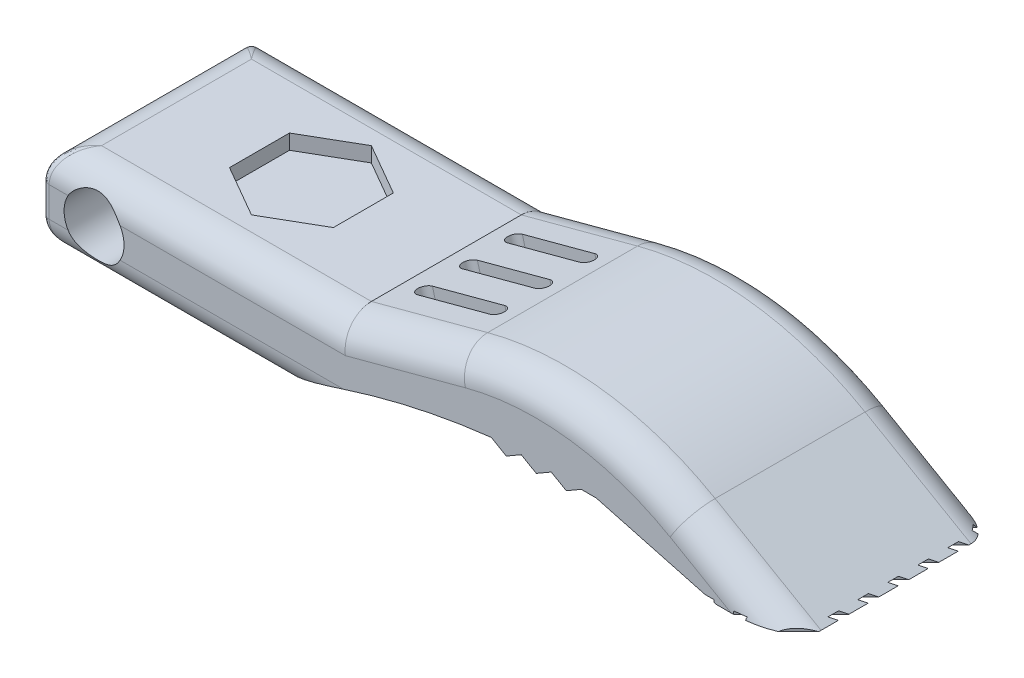
from build123d import *

# Parameters (mm, degrees)
BOSS_EXTRUDE1_DEPTH = 7
FILLET1_R           = 2
FILLET1_R_2         = 0.5
SKETCH2_R           = 2
CUT_EXTRUDE1_DEPTH  = 3
CUT_EXTRUDE2_DEPTH  = 1
CUT_EXTRUDE3_DEPTH  = 1
LPATTERN1_COUNT     = 2
LPATTERN1_PITCH     = 3
LPATTERN1_COL_COUNT = 2
LPATTERN1_COL_PITCH = 3
CUT_EXTRUDE4_DEPTH  = 0.2
LPATTERN3_START     = 2
LPATTERN3_DEPTH     = 0.2


# Read off the part's stored shape, not the designer's step: LPattern3
with BuildPart() as part:
    # Sketch1 → Boss-Extrude1 (new, symmetric)
    with BuildSketch(Plane.XY):
        with BuildLine():
            Line((0, 0), (0, 6))
            Line((0, 6), (20, 6))
            Line((20, 6), (27.756338699, 8.078304691))
            ThreePointArc((27.756338699, 8.078304691), (35.543243446, 8.588685392), (42.932719601, 6.080296241))
            Line((42.932719601, 6.080296241), (50, 2))
            Line((50, 2), (45, 2))
            Line((45, 2), (37, 4.143593539))
            Line((37, 4.143593539), (36, 4.143593539))
            Line((36, 4.143593539), (35, 3.56624327))
            Line((35, 3.56624327), (34, 4.143593539))
            Line((34, 4.143593539), (33, 3.56624327))
            Line((33, 3.56624327), (32, 4.143593539))
            Line((32, 4.143593539), (31, 3.56624327))
            Line((31, 3.56624327), (30, 4.143593539))
            ThreePointArc((30, 4.143593539), (22.337807681, 2.658940457), (15, 0))
            Line((15, 0), (0, 0))
        make_face()
    extrude(amount=BOSS_EXTRUDE1_DEPTH, both=True)

    # Fillet1
    fillet1_edges = [part.edges().sort_by_distance(p)[0] for p in [
        (10, 6, 7),
        (10, 6, -7),
        (23.87816935, 7.039152345, -7),
        (23.87816935, 7.039152345, 7),
        (7.5, 0, -7),
        (7.5, 0, 7),
        (0, 6, 0),
        (0, 0, 0),
        (35.543243446, 8.588685392, 7),
        (46.466359801, 4.04014812, 7),
        (35.543243446, 8.588685392, -7),
        (46.466359801, 4.04014812, -7),
    ]]
    fillet(fillet1_edges, radius=FILLET1_R)
    fillet1_2_edges = [part.edges().sort_by_distance(p)[0] for p in [
        (0, 3, 7),
        (0, 3, -7),
        (0.585786438, 0.585786438, -6.414213562),
        (0.585786438, 5.414213562, -6.414213562),
        (0.585786438, 0.585786438, 6.414213562),
        (0.585786438, 5.414213562, 6.414213562),
    ]]
    fillet(fillet1_2_edges, radius=FILLET1_R_2)

    # Sketch2 → Cut-Extrude1 (cut)
    with BuildSketch(Plane.XY.offset(7)):
        with Locations((3.5, 3)):
            Circle(SKETCH2_R)
    cut_extrude1 = extrude(amount=-CUT_EXTRUDE1_DEPTH, mode=Mode.SUBTRACT)

    # Mirror1: Cut-Extrude1 across plane
    add(cut_extrude1.mirror(Plane.XY), mode=Mode.SUBTRACT)

    # Sketch3 → Cut-Extrude2 (cut)
    with BuildSketch(Plane(origin=(0, 6, 0), x_dir=(1, 0, 0), z_dir=(0, 1, 0))):
        Polygon((14.464101615, -2), (14.464101615, 2), (11, 4), (7.535898385, 2), (7.535898385, -2), (11, -4), align=None)
    extrude(amount=-CUT_EXTRUDE2_DEPTH, mode=Mode.SUBTRACT)

    # Sketch4 → Cut-Extrude3 (cut)
    with BuildSketch(Plane(origin=(-0.160254038, 0.598076211, 0), x_dir=(0.9659258262890675, 0.2588190451025235, 0), z_dir=(-0.2588190451025235, 0.9659258262890675, 0))):
        with BuildLine():
            Line((22.5, 0.5), (27.5, 0.5))
            ThreePointArc((27.5, 0.5), (28, 0), (27.5, -0.5))
            Line((27.5, -0.5), (22.5, -0.5))
            ThreePointArc((22.5, -0.5), (22, 0), (22.5, 0.5))
        make_face()
    cut_extrude3 = extrude(amount=-CUT_EXTRUDE3_DEPTH, mode=Mode.SUBTRACT)

    # LPattern1: Cut-Extrude3 ×2
    with Locations(*[(0, 0, -i * LPATTERN1_PITCH) for i in range(1, LPATTERN1_COUNT)]):
        add(cut_extrude3, mode=Mode.SUBTRACT)

    # LPattern1 col: Cut-Extrude3 ×2
    with Locations(*[(0, 0, i * LPATTERN1_COL_PITCH) for i in range(1, LPATTERN1_COL_COUNT)]):
        add(cut_extrude3, mode=Mode.SUBTRACT)

    # Sketch5 → Cut-Extrude4 (cut)
    with BuildSketch(Plane.XZ.offset(-2)):
        Polygon((52.626524164, -5.480077554), (42.019922446, 5.126524164), (42.373475836, 5.480077554), (52.980077554, -5.126524164), align=None)
    extrude(amount=-CUT_EXTRUDE4_DEPTH, mode=Mode.SUBTRACT)

    # LPattern3 outline → LPattern3 (cut)
    with BuildSketch(Plane(origin=(0, 0, 0), x_dir=(1, 0, 0), z_dir=(0, 1, 0)).offset(LPATTERN3_START)):
        Polygon((52, -3.146446612), (49.987319121, -5.159127489), (48.646995454, -6.499451155), (48.146446609, -7), (52, -7), align=None)
        Polygon((50, -3.853553391), (52, -1.853553392), (52, -1.146446609), (46.146446609, -7), (46.85355339, -7), (46.905469383, -6.948084007), align=None)
        Polygon((44.853553391, -7), (52, 0.146446609), (52, 0.853553391), (44.146446609, -7), align=None)
        Polygon((50, 0.146446609), (52, 2.146446609), (52, 2.853553391), (43, -6.146446609), (43, -6.85355339), (44.253589838, -5.599963552), align=None)
        Polygon((50, 4.146446609), (52, 6.146446609), (52, 6.853553391), (43, -2.146446609), (43, -2.85355339), (44.253589838, -1.599963552), align=None)
        Polygon((49.660216042, 5.806662651), (50.853553391, 7), (50.14644661, 7), (49.286501964, 6.140055354), (44.253589838, 1.107143229), (43, -0.146446609), (43, -0.85355339), (44.253589838, 0.400036448), align=None)
        Polygon((48.438812945, 6.585259554), (48.853553391, 7), (48.14644661, 7), (47.905052291, 6.758605681), (44.253589838, 3.107143229), (43, 1.853553391), (43, 1.14644661), (44.253589838, 2.400036448), align=None)
        Polygon((46.811919237, 6.958365846), (46.853553391, 7), (46.146446609, 7), (43, 3.853553391), (43, 3.14644661), (44.253589838, 4.400036448), align=None)
        Polygon((44.253589838, 6.400036448), (44.853553391, 7), (43, 7), (43, 5.146446612), align=None)
    extrude(amount=LPATTERN3_DEPTH, mode=Mode.SUBTRACT)


solid = part.part
